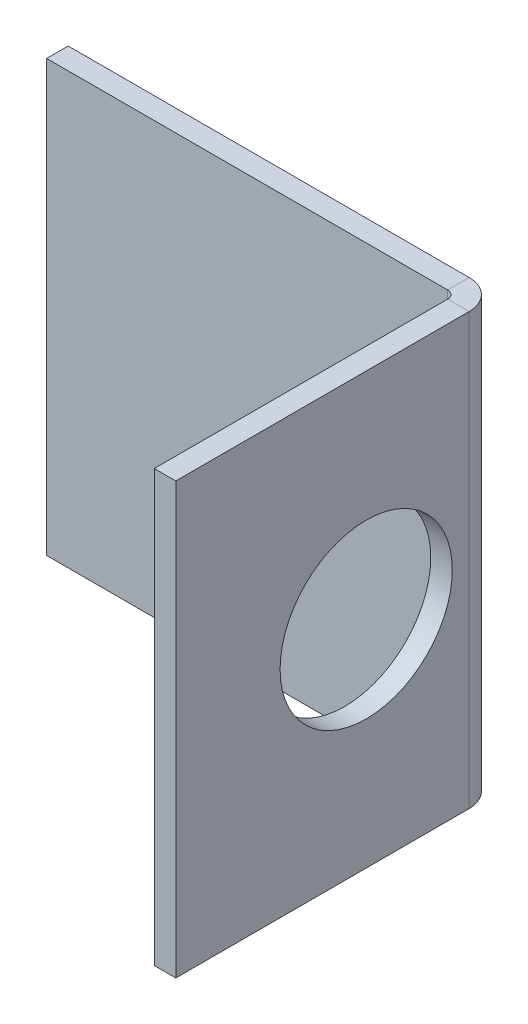
from build123d import *

# Parameters (mm, degrees)
CROQUIS1_W                       = 40
CROQUIS1_H                       = 40
BRIDA_BASE1_DEPTH                = 2
BRIDA_DE_ARISTA1_STRIP_W         = 9.4732
BRIDA_DE_ARISTA1_STRIP_H         = 2
BRIDA_DE_ARISTA1_STRIP_CUT_DEPTH = 40
BRIDA_DE_ARISTA1_DEPTH           = 40
CORTAR_EXTRUIR2_REACH            = 54.383
CROQUIS11_R                      = 8


# Sheet-metal steps are written as plain solids
with BuildPart() as part:
    # Croquis1 → Brida base1 (new body)
    with BuildSketch(Plane.XY):
        Rectangle(CROQUIS1_W, CROQUIS1_H)
    extrude(amount=BRIDA_BASE1_DEPTH)

    # Brida de arista1 strip (across the edge) → Brida de arista1 strip cut (cut)
    with BuildSketch(Plane(origin=(20, -20, 2), x_dir=(-1, 0, 0), z_dir=(0, 1, 0))):
        with Locations((-2, -1)):
            Rectangle(BRIDA_DE_ARISTA1_STRIP_W, BRIDA_DE_ARISTA1_STRIP_H)
    extrude(amount=BRIDA_DE_ARISTA1_STRIP_CUT_DEPTH, mode=Mode.SUBTRACT)

    # Brida de arista1 section (across the edge) → Brida de arista1 (add)
    with BuildSketch(Plane(origin=(20, -20, 2), x_dir=(-1, 0, 0), z_dir=(0, 1, 0))):
        with BuildLine():
            Line((0, 0.7366), (0, 28))
            Line((0, 28), (2, 28))
            Line((2, 28), (2, 0.7366))
            ThreePointArc((2, 0.7366), (2.215745145, 0.215745145), (2.7366, 0))
            Line((2.7366, 0), (2.7366, -2))
            ThreePointArc((2.7366, -2), (0.801531583, -1.198468417), (0, 0.7366))
        make_face()
    extrude(amount=BRIDA_DE_ARISTA1_DEPTH)

    # Croquis11 → Cortar-Extruir2 (cut, up to next)
    with BuildSketch(Plane.ZY.offset(-18), mode=Mode.PRIVATE) as cortar_extruir2_sk1:
        with Locations((12.31, 0)):
            Circle(CROQUIS11_R)
    cortar_extruir2_tool1 = extrude(cortar_extruir2_sk1.sketch, amount=-CORTAR_EXTRUIR2_REACH, mode=Mode.PRIVATE) & part.part
    add(cortar_extruir2_tool1.solids().sort_by_distance((18, 0, 12.31))[0], mode=Mode.SUBTRACT)


solid = part.part
